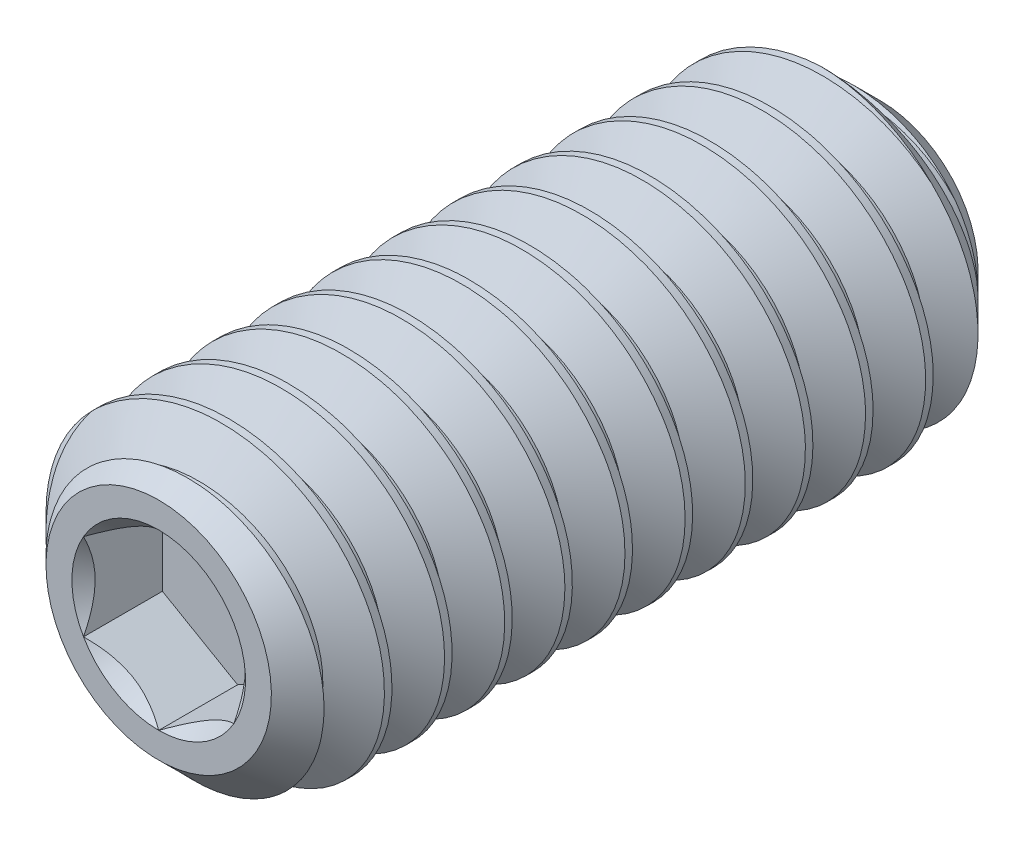
from build123d import *

# Parameters (mm, degrees)
CHAMFER1_SIZE      = 0.79375
CUT_EXTRUDE1_START = -1.0414
CUT_EXTRUDE1_DEPTH = 1.0414
SKETCH4_R          = 1.14567944
CUT_EXTRUDE2_DEPTH = 1.0414
CUT_EXTRUDE2_DRAFT = -45
CUT_SWEEP1_PITCH   = 0.79375


with BuildPart() as part:
    # Sketch2 → Revolve1 (revolve)
    with BuildSketch(Plane(origin=(0, 0, 0), x_dir=(0, 0, -1), z_dir=(1, 0, 0))):
        Polygon((4.7625, 1.239440625), (4.017768939, 0), (-4.7625, 0), (-4.7625, 1.4874875), (-4.1671875, 2.0828), (4.7625, 2.0828), align=None)
    revolve(axis=Axis((0, 0, -4.017768939), (0, 0, 1)))

    # Chamfer1
    chamfer1_edges = [part.edges().sort_by_distance(p)[0] for p in [
        (0, -2.0828, -4.7625),
    ]]
    chamfer(chamfer1_edges, length=CHAMFER1_SIZE)

    # Sketch3 → Cut-Extrude1 (cut)
    with BuildSketch(Plane.XY.offset(4.7625).offset(CUT_EXTRUDE1_START)):
        Polygon((-0.9921875, -0.57283972), (0, -1.14567944), (0.9921875, -0.57283972), (0.9921875, 0.57283972), (0, 1.14567944), (-0.9921875, 0.57283972), align=None)
    extrude(amount=CUT_EXTRUDE1_DEPTH, mode=Mode.SUBTRACT)


with BuildPart() as cut_extrude2_tool:
    # Sketch4 → Cut-Extrude2 (with draft: the straight prism first)
    with BuildSketch(Plane.XY.offset(4.7625)):
        Circle(SKETCH4_R)
    extrude(amount=-CUT_EXTRUDE2_DEPTH)
    # Cut-Extrude2: the draft: its side faces are tilted about the plane it starts from
    cut_extrude2_sides = [cut_extrude2_tool.faces().sort_by_distance(p)[0] for p in [
        (-1.14567944, 0, 4.2418),
    ]]
    draft(cut_extrude2_sides, Plane.XY.offset(4.7625), CUT_EXTRUDE2_DRAFT)


with BuildPart() as part_1:
    add(part.part)

    # Cut-Extrude2: cut by cut_extrude2_tool
    add(cut_extrude2_tool.part, mode=Mode.SUBTRACT)

    # Cut-Sweep1: the profile of Sketch8 screwed along a right-hand helix of 13.01 turns, 8 arcs to a turn; built about Z, then put on its axis
    cut_sweep1_z = Axis((0, 0, 0), (0, 0, 1))
    cut_sweep1_corners = [(1.567244252, 0, -0.396875), (1.567244252, 0, -0.29765625), (2.125762979, 0, 0.024804688), (2.125762979, 0, -0.719335938)]
    with BuildLine(mode=Mode.PRIVATE) as cut_sweep1_profile:
        Line(cut_sweep1_corners[0], cut_sweep1_corners[1])
        Line(cut_sweep1_corners[1], cut_sweep1_corners[2])
        Line(cut_sweep1_corners[2], cut_sweep1_corners[3])
        Line(cut_sweep1_corners[3], cut_sweep1_corners[0])
    cut_sweep1_cap = Face(cut_sweep1_profile.wire())
    cut_sweep1_turn_angles = [0, 22.5, 45, 67.5, 90, 112.5, 135, 157.5, 180, 202.5, 225, 247.5, 270, 292.5, 315, 337.5, 360]
    cut_sweep1_turn_weights = [1, 0.9238795325112867, 1, 0.9238795325112867, 1, 0.9238795325112867, 1, 0.9238795325112867, 1, 0.9238795325112867, 1, 0.9238795325112867, 1, 0.9238795325112867, 1, 0.9238795325112867, 1]
    cut_sweep1_turn_rails = [Edge.make_bspline([Vector(p[0], p[1], 0).rotate(cut_sweep1_z, cut_sweep1_turn_angles[k]) / cut_sweep1_turn_weights[k] + Vector(0, 0, p[2] + CUT_SWEEP1_PITCH * cut_sweep1_turn_angles[k] / 360) for k in range(17)], [0, 0, 0, 1, 1, 2, 2, 3, 3, 4, 4, 5, 5, 6, 6, 7, 7, 8, 8, 8], 2, cut_sweep1_turn_weights) for p in cut_sweep1_corners]
    cut_sweep1_turn_sides = [Face.make_surface_from_curves(cut_sweep1_turn_rails[p[0]], cut_sweep1_turn_rails[p[1]]) for p in [(0, 1), (1, 2), (2, 3), (3, 0)]]
    cut_sweep1_last_angles = [4680, 4681.8, 4683.6]
    cut_sweep1_last_weights = [1, 0.9995065603657309, 1]
    cut_sweep1_last_rails = [Edge.make_bspline([Vector(p[0], p[1], 0).rotate(cut_sweep1_z, cut_sweep1_last_angles[k]) / cut_sweep1_last_weights[k] + Vector(0, 0, p[2] + CUT_SWEEP1_PITCH * cut_sweep1_last_angles[k] / 360) for k in range(3)], [0, 0, 0, 1, 1, 1], 2, cut_sweep1_last_weights) for p in cut_sweep1_corners]
    cut_sweep1_last_sides = [Face.make_surface_from_curves(cut_sweep1_last_rails[p[0]], cut_sweep1_last_rails[p[1]]) for p in [(0, 1), (1, 2), (2, 3), (3, 0)]]
    cut_sweep1 = Plane(origin=(0, 0, -4.7625), x_dir=(0, 1, 0), z_dir=(0, 0, 1)) * Solid(Shell([*[p.moved(Location((0, 0, CUT_SWEEP1_PITCH * i))) for i in range(13) for p in cut_sweep1_turn_sides], *cut_sweep1_last_sides, cut_sweep1_cap, cut_sweep1_cap.rotate(cut_sweep1_z, 4683.6).moved(Location((0, 0, CUT_SWEEP1_PITCH * 4683.6 / 360)))]))
    add(cut_sweep1, mode=Mode.SUBTRACT)


solid = part_1.part
